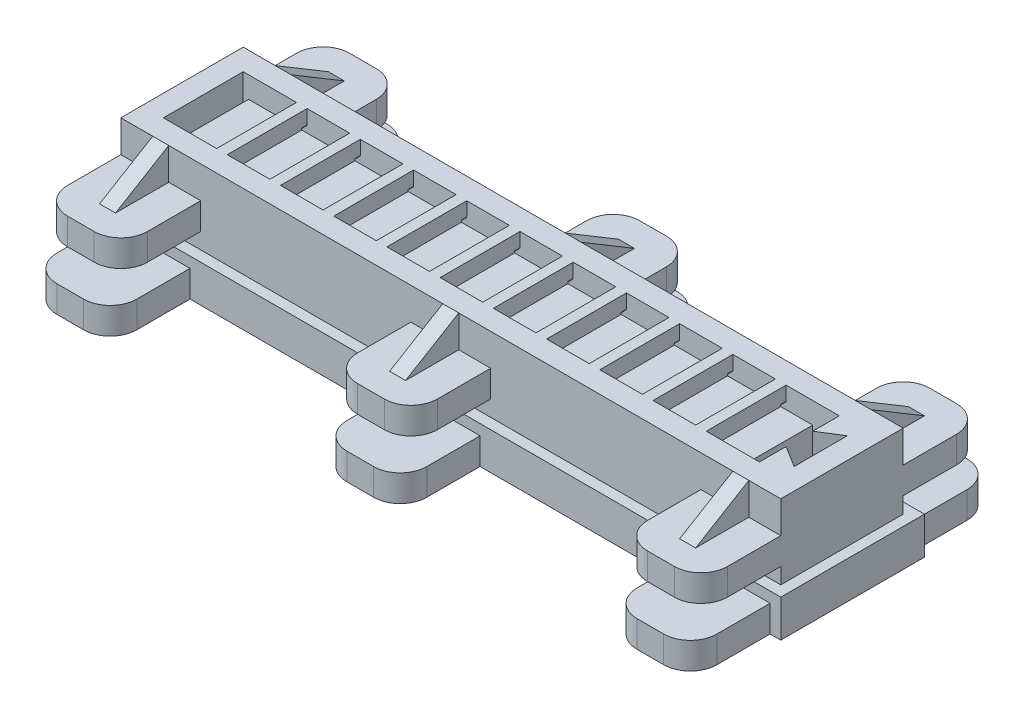
from build123d import *
from OCP.BRepFilletAPI import BRepFilletAPI_MakeChamfer

# Parameters (mm, degrees)
SKETCH1_W                       = 8
SKETCH1_H                       = 15
FIRST_CHAMBER_BLOCK_DEPTH       = 15
SKETCH2_W                       = 6
SKETCH2_H                       = 11
FIRST_CHAMBER_CAVITY_DEPTH      = 13
SKETCH3_W                       = 15
SKETCH3_H                       = 3
CHAMBER_SPACER_DEPTH            = 2
PATTERN_CHAMBERS_COUNT          = 11
PATTERN_CHAMBERS_PITCH          = 10
SKETCH4_W                       = 15
SKETCH4_H                       = 12
THICKEN_END_1_DEPTH             = 2
SKETCH5_W                       = 15
SKETCH5_H                       = 15
THICKEN_END_2_DEPTH             = 2
SKETCH6_W                       = 94
SKETCH6_H                       = 2
CENTRAL_AIR_CHANNEL_DEPTH       = 2
SKETCH7_W                       = 108
SKETCH7_H                       = 13
SKETCH7_W_2                     = 106
SKETCH7_H_2                     = 11
BONDING_RIDGE_DEPTH             = 2
SKETCH9_W                       = 2
SKETCH9_H                       = 2.5
BONDING_BUMPS_DEPTH             = 2
PATTERN_BONDING_BUMPS_COUNT     = 10
PATTERN_BONDING_BUMPS_PITCH     = 10
AUFSATZ_LINEAR_AUSTRAGEN3_REACH = 106.183
SCHNITT_LINEAR_AUSTRAGEN2_DEPTH = 113.026782512
LINEARES_MUSTER8_COUNT          = 10
LINEARES_MUSTER8_PITCH          = 10
BOSS_EXTRUDE1_START             = -15
BOSS_EXTRUDE1_DEPTH             = 15
ENCASING_BLOCK_DEPTH            = 21
SPLIT_START                     = -6
SPLIT_MOLD_OUTLINE_W            = 124
SPLIT_MOLD_OUTLINE_H            = 23
SPLIT_MOLD_DEPTH                = 6
SPLIT_MOLD_2_OUTLINE_W          = 6
SPLIT_MOLD_2_OUTLINE_H          = 11
SPLIT_MOLD_2_DEPTH              = 13
SPLIT_MOLD_3_OUTLINE_W          = 4
SPLIT_MOLD_3_OUTLINE_H          = 2
SPLIT_MOLD_3_DEPTH              = 2
SPLIT_START_2                   = 2
SPLIT_MOLD_4_DEPTH              = 11
SPLIT_START_3                   = -4
SPLIT_MOLD_5_DEPTH              = 23
SPLIT_MOLD_6_OUTLINE_W          = 108
SPLIT_MOLD_6_OUTLINE_H          = 2
SPLIT_MOLD_6_DEPTH              = 5
SPLIT_START_4                   = 14
SPLIT_MOLD_7_OUTLINE_W          = 108
SPLIT_MOLD_7_OUTLINE_H          = 2
SPLIT_MOLD_7_DEPTH              = 5
SPLIT_START_5                   = 6.5
SPLIT_MOLD_8_DEPTH              = 2
SPLIT_START_6                   = 5.5
SPLIT_MOLD_9_OUTLINE_W          = 2
SPLIT_MOLD_9_OUTLINE_H          = 2
SPLIT_MOLD_9_DEPTH              = 4
SPLIT_MOLD_10_OUTLINE_W         = 2
SPLIT_MOLD_10_OUTLINE_H         = 2
SPLIT_MOLD_10_DEPTH             = 1
SPLIT_START_7                   = 12
SPLIT_MOLD_11_OUTLINE_W         = 2
SPLIT_MOLD_11_OUTLINE_H         = 2
SPLIT_MOLD_11_DEPTH             = 1
SKETCH11_W                      = 15
SKETCH11_H                      = 5
GRIP_TAB_1_DEPTH                = 15
VERRUNDUNG1_R                   = 5
SKETCH13_W                      = 128
SKETCH13_H                      = 27
SKETCH13_W_2                    = 124
SKETCH13_H_2                    = 23
BASE_MOLD_LIP_DEPTH             = 7
SKETCH14_W                      = 15
SKETCH14_H                      = 5
BASE_GRIP_TABS_1_AND_2_DEPTH    = 15
SKETCH16_W                      = 15
SKETCH16_H                      = 5
BASE_GRIP_TABS_3_AND_4_DEPTH    = 15
FILLET_BASE_GRIP_TABS_R         = 5
SKIZZE1_W                       = 3
SKIZZE1_H                       = 6
AUFSATZ_LINEAR_AUSTRAGEN1_DEPTH = 10
FASE1_SIZE                      = 10
FASE1_SIZE_2                    = 6
FASE2_SIZE                      = 10
FASE2_SIZE_2                    = 6


# Read off the part's stored shape, not the designer's step: split mold
with BuildPart() as part:
    # Sketch1 → first chamber block (new body)
    with BuildSketch(Plane.XY):
        with Locations((4, 7.5)):
            Rectangle(SKETCH1_W, SKETCH1_H)
    extrude(amount=FIRST_CHAMBER_BLOCK_DEPTH)

    # Sketch2 → first chamber cavity (cut)
    with BuildSketch(Plane.XZ):
        with Locations((4, 7.5)):
            Rectangle(SKETCH2_W, SKETCH2_H)
    extrude(amount=-FIRST_CHAMBER_CAVITY_DEPTH, mode=Mode.SUBTRACT)

    # Sketch3 → chamber spacer (add)
    with BuildSketch(Plane(origin=(8, 0, 0), x_dir=(0, 0, -1), z_dir=(1, 0, 0))):
        with Locations((-7.5, 1.5)):
            Rectangle(SKETCH3_W, SKETCH3_H)
    extrude(amount=CHAMBER_SPACER_DEPTH)


with BuildPart() as pattern_chambers_1:
    # pattern chambers: pattern copy
    add(part.part.moved(Location(Vector(1, 0, 0) * (1 * PATTERN_CHAMBERS_PITCH))))


with BuildPart() as pattern_chambers_2:
    # pattern chambers: pattern copy
    add(part.part.moved(Location(Vector(1, 0, 0) * (2 * PATTERN_CHAMBERS_PITCH))))


with BuildPart() as pattern_chambers_3:
    # pattern chambers: pattern copy
    add(part.part.moved(Location(Vector(1, 0, 0) * (3 * PATTERN_CHAMBERS_PITCH))))


with BuildPart() as pattern_chambers_4:
    # pattern chambers: pattern copy
    add(part.part.moved(Location(Vector(1, 0, 0) * (4 * PATTERN_CHAMBERS_PITCH))))


with BuildPart() as pattern_chambers_5:
    # pattern chambers: pattern copy
    add(part.part.moved(Location(Vector(1, 0, 0) * (5 * PATTERN_CHAMBERS_PITCH))))


with BuildPart() as pattern_chambers_6:
    # pattern chambers: pattern copy
    add(part.part.moved(Location(Vector(1, 0, 0) * (6 * PATTERN_CHAMBERS_PITCH))))


with BuildPart() as pattern_chambers_7:
    # pattern chambers: pattern copy
    add(part.part.moved(Location(Vector(1, 0, 0) * (7 * PATTERN_CHAMBERS_PITCH))))


with BuildPart() as pattern_chambers_8:
    # pattern chambers: pattern copy
    add(part.part.moved(Location(Vector(1, 0, 0) * (8 * PATTERN_CHAMBERS_PITCH))))


with BuildPart() as pattern_chambers_9:
    # pattern chambers: pattern copy
    add(part.part.moved(Location(Vector(1, 0, 0) * (9 * PATTERN_CHAMBERS_PITCH))))


with BuildPart() as pattern_chambers_10:
    # pattern chambers: pattern copy
    add(part.part.moved(Location(Vector(1, 0, 0) * (10 * PATTERN_CHAMBERS_PITCH))))

    # combine into 1 solid body: union pattern chambers_9, pattern chambers_8, pattern chambers_7, pattern chambers_6, pattern chambers_5, pattern chambers_4, pattern chambers_3, pattern chambers_2, pattern chambers_1, part
    add(pattern_chambers_9.part)
    add(pattern_chambers_8.part)
    add(pattern_chambers_7.part)
    add(pattern_chambers_6.part)
    add(pattern_chambers_5.part)
    add(pattern_chambers_4.part)
    add(pattern_chambers_3.part)
    add(pattern_chambers_2.part)
    add(pattern_chambers_1.part)
    add(part.part)

    # Sketch4 → thicken end 1 (add)
    with BuildSketch(Plane(origin=(108, 0, 0), x_dir=(0, 0, -1), z_dir=(1, 0, 0))):
        with Locations((-7.5, 9)):
            Rectangle(SKETCH4_W, SKETCH4_H)
    extrude(amount=THICKEN_END_1_DEPTH)

    # Sketch5 → thicken end 2 (add)
    with BuildSketch(Plane.ZY):
        with Locations((7.5, 7.5)):
            Rectangle(SKETCH5_W, SKETCH5_H)
    extrude(amount=THICKEN_END_2_DEPTH)

    # Sketch6 → central air channel (cut)
    with BuildSketch(Plane.XZ):
        with Locations((54, 7.5)):
            Rectangle(SKETCH6_W, SKETCH6_H)
    extrude(amount=-CENTRAL_AIR_CHANNEL_DEPTH, mode=Mode.SUBTRACT)

    # Sketch7 → bonding ridge (add)
    with BuildSketch(Plane.XZ):
        with Locations((54, 7.5)):
            Rectangle(SKETCH7_W, SKETCH7_H)
        with Locations((54, 7.5)):
            Rectangle(SKETCH7_W_2, SKETCH7_H_2, mode=Mode.SUBTRACT)
    extrude(amount=BONDING_RIDGE_DEPTH)

    # Sketch9 → bonding bumps (add)
    with BuildSketch(Plane.XZ):
        with Locations((9, 10.75)):
            Rectangle(SKETCH9_W, SKETCH9_H)
        with Locations((9, 4.25)):
            Rectangle(SKETCH9_W, SKETCH9_H)
    bonding_bumps = extrude(amount=BONDING_BUMPS_DEPTH)

    # pattern bonding bumps: bonding bumps ×10
    with Locations(*[(i * PATTERN_BONDING_BUMPS_PITCH, 0, 0) for i in range(1, PATTERN_BONDING_BUMPS_COUNT)]):
        add(bonding_bumps)

    # Skizze3 → Aufsatz-Linear austragen3 (add, up to next)
    with BuildSketch(Plane(origin=(8, 0, 0), x_dir=(0, 0, -1), z_dir=(1, 0, 0)), mode=Mode.PRIVATE) as aufsatz_linear_austragen3_sk1:
        Polygon((-15, 3), (-13.5, 3), (-14, 12.5), (-15, 12.5), align=None)
    aufsatz_linear_austragen3_tool1 = extrude(aufsatz_linear_austragen3_sk1.sketch, amount=AUFSATZ_LINEAR_AUSTRAGEN3_REACH, mode=Mode.PRIVATE) - pattern_chambers_10.part
    # Skizze3 → Aufsatz-Linear austragen3 (add, up to next)
    with BuildSketch(Plane(origin=(8, 0, 0), x_dir=(0, 0, -1), z_dir=(1, 0, 0)), mode=Mode.PRIVATE) as aufsatz_linear_austragen3_sk2:
        Polygon((0, 12.5), (0, 3), (-1.5, 3), (-1, 12.5), align=None)
    aufsatz_linear_austragen3_tool2 = extrude(aufsatz_linear_austragen3_sk2.sketch, amount=AUFSATZ_LINEAR_AUSTRAGEN3_REACH, mode=Mode.PRIVATE) - pattern_chambers_10.part
    aufsatz_linear_austragen3_1 = aufsatz_linear_austragen3_tool1.solids().sort_by_distance((8, 7.433333, 14.366667))[0]
    add(aufsatz_linear_austragen3_1)
    aufsatz_linear_austragen3_2 = aufsatz_linear_austragen3_tool2.solids().sort_by_distance((8, 7.433333, 0.633333))[0]
    add(aufsatz_linear_austragen3_2)
    aufsatz_linear_austragen3 = aufsatz_linear_austragen3_1 + aufsatz_linear_austragen3_2  # Aufsatz-Linear austragen3 as one shape, for the pattern or mirror that repeats it

    # Skizze5 → Schnitt-Linear austragen2 (cut, through all)
    with BuildSketch(Plane(origin=(0, 0, 0), x_dir=(-1, 0, 0), z_dir=(0, 0, -1))):
        with BuildLine():
            Line((-10, 12.5), (-8, 12.5))
            Line((-8, 12.5), (-8, 12.45))
            ThreePointArc((-8, 12.45), (-8.131801948, 12.131801948), (-8.45, 12))
            Line((-8.45, 12), (-9.55, 12))
            ThreePointArc((-9.55, 12), (-9.868198052, 12.131801948), (-10, 12.45))
            Line((-10, 12.45), (-10, 12.5))
        make_face()
    schnitt_linear_austragen2 = extrude(amount=-SCHNITT_LINEAR_AUSTRAGEN2_DEPTH, mode=Mode.SUBTRACT)

    # Lineares Muster8: Aufsatz-Linear austragen3, Schnitt-Linear austragen2 ×10
    with Locations(*[(i * LINEARES_MUSTER8_PITCH, 0, 0) for i in range(1, LINEARES_MUSTER8_COUNT)]):
        add(aufsatz_linear_austragen3)
        add(schnitt_linear_austragen2, mode=Mode.SUBTRACT)

    # Sketch18 → Boss-Extrude1 (add)
    with BuildSketch(Plane(origin=(0, 15, 0), x_dir=(1, 0, 0), z_dir=(0, 1, 0)).offset(BOSS_EXTRUDE1_START)):
        Polygon((110, -5), (114, -2.5), (114, -12.5), (110, -10), align=None)
    extrude(amount=BOSS_EXTRUDE1_DEPTH)


with BuildPart() as body_2:
    # Sketch10 → encasing block (new body)
    with BuildSketch(Plane(origin=(0, 15, 0), x_dir=(1, 0, 0), z_dir=(0, 1, 0))):
        Polygon((-6, 4), (114, 4), (118, 4), (118, -19), (114, -19), (-6, -19), align=None)
    extrude(amount=-ENCASING_BLOCK_DEPTH)

    # subtract actuator: cut pattern chambers_10
    add(pattern_chambers_10.part, mode=Mode.SUBTRACT)

    # split mold outline → split mold (cut)
    with BuildSketch(Plane(origin=(0, 0, 0), x_dir=(1, 0, 0), z_dir=(0, 1, 0)).offset(SPLIT_START)):
        with Locations((56, -7.5)):
            Rectangle(SPLIT_MOLD_OUTLINE_W, SPLIT_MOLD_OUTLINE_H)
    extrude(amount=SPLIT_MOLD_DEPTH, mode=Mode.SUBTRACT)

    # split mold 2 outline → split mold 2 (cut)
    with BuildSketch(Plane(origin=(0, 0, 0), x_dir=(1, 0, 0), z_dir=(0, 1, 0))):
        with Locations((14, -7.5)):
            Rectangle(SPLIT_MOLD_2_OUTLINE_W, SPLIT_MOLD_2_OUTLINE_H)
        with Locations((4, -7.5)):
            Rectangle(SPLIT_MOLD_2_OUTLINE_W, SPLIT_MOLD_2_OUTLINE_H)
        with Locations((24, -7.5)):
            Rectangle(SPLIT_MOLD_2_OUTLINE_W, SPLIT_MOLD_2_OUTLINE_H)
        with Locations((34, -7.5)):
            Rectangle(SPLIT_MOLD_2_OUTLINE_W, SPLIT_MOLD_2_OUTLINE_H)
        with Locations((44, -7.5)):
            Rectangle(SPLIT_MOLD_2_OUTLINE_W, SPLIT_MOLD_2_OUTLINE_H)
        with Locations((54, -7.5)):
            Rectangle(SPLIT_MOLD_2_OUTLINE_W, SPLIT_MOLD_2_OUTLINE_H)
        with Locations((64, -7.5)):
            Rectangle(SPLIT_MOLD_2_OUTLINE_W, SPLIT_MOLD_2_OUTLINE_H)
        with Locations((74, -7.5)):
            Rectangle(SPLIT_MOLD_2_OUTLINE_W, SPLIT_MOLD_2_OUTLINE_H)
        with Locations((84, -7.5)):
            Rectangle(SPLIT_MOLD_2_OUTLINE_W, SPLIT_MOLD_2_OUTLINE_H)
        with Locations((94, -7.5)):
            Rectangle(SPLIT_MOLD_2_OUTLINE_W, SPLIT_MOLD_2_OUTLINE_H)
        with Locations((104, -7.5)):
            Rectangle(SPLIT_MOLD_2_OUTLINE_W, SPLIT_MOLD_2_OUTLINE_H)
    extrude(amount=SPLIT_MOLD_2_DEPTH, mode=Mode.SUBTRACT)

    # split mold 3 outline → split mold 3 (cut)
    with BuildSketch(Plane(origin=(0, 0, 0), x_dir=(1, 0, 0), z_dir=(0, 1, 0))):
        with Locations((9, -7.5)):
            Rectangle(SPLIT_MOLD_3_OUTLINE_W, SPLIT_MOLD_3_OUTLINE_H)
        with Locations((19, -7.5)):
            Rectangle(SPLIT_MOLD_3_OUTLINE_W, SPLIT_MOLD_3_OUTLINE_H)
        with Locations((29, -7.5)):
            Rectangle(SPLIT_MOLD_3_OUTLINE_W, SPLIT_MOLD_3_OUTLINE_H)
        with Locations((39, -7.5)):
            Rectangle(SPLIT_MOLD_3_OUTLINE_W, SPLIT_MOLD_3_OUTLINE_H)
        with Locations((49, -7.5)):
            Rectangle(SPLIT_MOLD_3_OUTLINE_W, SPLIT_MOLD_3_OUTLINE_H)
        with Locations((59, -7.5)):
            Rectangle(SPLIT_MOLD_3_OUTLINE_W, SPLIT_MOLD_3_OUTLINE_H)
        with Locations((69, -7.5)):
            Rectangle(SPLIT_MOLD_3_OUTLINE_W, SPLIT_MOLD_3_OUTLINE_H)
        with Locations((79, -7.5)):
            Rectangle(SPLIT_MOLD_3_OUTLINE_W, SPLIT_MOLD_3_OUTLINE_H)
        with Locations((89, -7.5)):
            Rectangle(SPLIT_MOLD_3_OUTLINE_W, SPLIT_MOLD_3_OUTLINE_H)
        with Locations((99, -7.5)):
            Rectangle(SPLIT_MOLD_3_OUTLINE_W, SPLIT_MOLD_3_OUTLINE_H)
    extrude(amount=SPLIT_MOLD_3_DEPTH, mode=Mode.SUBTRACT)

    # Sketch11 → grip tab 1 (add)
    with BuildSketch(Plane.XY.offset(19)):
        with Locations((1.5, 6.5)):
            Rectangle(SKETCH11_W, SKETCH11_H)
        with Locations((56, 6.5)):
            Rectangle(SKETCH11_W, SKETCH11_H)
        with Locations((110.5, 6.5)):
            Rectangle(SKETCH11_W, SKETCH11_H)
    grip_tab_1 = extrude(amount=GRIP_TAB_1_DEPTH)

    # Spiegeln1: grip tab 1 across plane
    add(grip_tab_1.mirror(Plane(origin=(0, 0, 7.5), x_dir=(1, 0, 0), z_dir=(0, 0, -1))))

    # Verrundung1
    verrundung1_edges = [body_2.edges().sort_by_distance(p)[0] for p in [
        (-6, 6.5, -19),
        (9, 6.5, -19),
        (48.5, 6.5, -19),
        (63.5, 6.5, -19),
        (103, 6.5, -19),
        (118, 6.5, -19),
        (118, 6.5, 34),
        (103, 6.5, 34),
        (63.5, 6.5, 34),
        (48.5, 6.5, 34),
        (9, 6.5, 34),
        (-6, 6.5, 34),
    ]]
    fillet(verrundung1_edges, radius=VERRUNDUNG1_R)

    # Skizze1 → Aufsatz-Linear austragen1 (add)
    with BuildSketch(Plane.XY.offset(19)):
        with Locations((1.5, 12)):
            Rectangle(SKIZZE1_W, SKIZZE1_H)
        with Locations((56, 12)):
            Rectangle(SKIZZE1_W, SKIZZE1_H)
        with Locations((110.5, 12)):
            Rectangle(SKIZZE1_W, SKIZZE1_H)
    aufsatz_linear_austragen1 = extrude(amount=AUFSATZ_LINEAR_AUSTRAGEN1_DEPTH)

    # Spiegeln2: Aufsatz-Linear austragen1 across plane
    add(aufsatz_linear_austragen1.mirror(Plane(origin=(0, 0, 7.5), x_dir=(1, 0, 0), z_dir=(0, 0, -1))))

    # Fase1
    fase1_edges_1 = [body_2.edges().sort_by_distance(p)[0] for p in [
        (1.5, 15, 29),
    ]]
    fase1_side_1 = [body_2.faces().sort_by_distance(p)[0] for p in [
        (1.5, 15, 28.88),
    ]]
    fase1_edges_2 = [body_2.edges().sort_by_distance(p)[0] for p in [
        (110.5, 15, 29),
    ]]
    fase1_side_2 = [body_2.faces().sort_by_distance(p)[0] for p in [
        (110.5, 15, 28.88),
    ]]
    fase1_edges_3 = [body_2.edges().sort_by_distance(p)[0] for p in [
        (56, 15, 29),
    ]]
    fase1_side_3 = [body_2.faces().sort_by_distance(p)[0] for p in [
        (56, 15, 28.88),
    ]]
    fase1 = BRepFilletAPI_MakeChamfer(body_2.part.solid().wrapped)
    for e in fase1_edges_1:
        fase1.Add(FASE1_SIZE - 0.0001, FASE1_SIZE_2 - 0.0001, e.wrapped, fase1_side_1[0].wrapped)
    for e in fase1_edges_2:
        fase1.Add(FASE1_SIZE - 0.0001, FASE1_SIZE_2 - 0.0001, e.wrapped, fase1_side_2[0].wrapped)
    for e in fase1_edges_3:
        fase1.Add(FASE1_SIZE - 0.0001, FASE1_SIZE_2 - 0.0001, e.wrapped, fase1_side_3[0].wrapped)
    add(Compound.cast(fase1.Shape()), mode=Mode.REPLACE)  # a hair under: the kernel refuses the full size

    # Fase2
    fase2_edges_1 = [body_2.edges().sort_by_distance(p)[0] for p in [
        (110.5, 15, -14),
    ]]
    fase2_side_1 = [body_2.faces().sort_by_distance(p)[0] for p in [
        (110.5, 15, -13.88),
    ]]
    fase2_edges_2 = [body_2.edges().sort_by_distance(p)[0] for p in [
        (56, 15, -14),
    ]]
    fase2_side_2 = [body_2.faces().sort_by_distance(p)[0] for p in [
        (56, 15, -13.88),
    ]]
    fase2_edges_3 = [body_2.edges().sort_by_distance(p)[0] for p in [
        (1.5, 15, -14),
    ]]
    fase2_side_3 = [body_2.faces().sort_by_distance(p)[0] for p in [
        (1.5, 15, -13.88),
    ]]
    fase2 = BRepFilletAPI_MakeChamfer(body_2.part.solid().wrapped)
    for e in fase2_edges_1:
        fase2.Add(FASE2_SIZE - 0.0001, FASE2_SIZE_2 - 0.0001, e.wrapped, fase2_side_1[0].wrapped)
    for e in fase2_edges_2:
        fase2.Add(FASE2_SIZE - 0.0001, FASE2_SIZE_2 - 0.0001, e.wrapped, fase2_side_2[0].wrapped)
    for e in fase2_edges_3:
        fase2.Add(FASE2_SIZE - 0.0001, FASE2_SIZE_2 - 0.0001, e.wrapped, fase2_side_3[0].wrapped)
    add(Compound.cast(fase2.Shape()), mode=Mode.REPLACE)  # a hair under: the kernel refuses the full size


with BuildPart() as body_2_2:
    # split mold 4 outline → split mold 4 (new body)
    with BuildSketch(Plane.XY.offset(SPLIT_START_2)):
        Polygon((7, 0), (7, 13), (1, 13), (1, -2), (0, -2), (0, 0), (-6, 0), (-6, -6), (118, -6), (118, 0), (108, 0), (108, -2), (107, -2), (107, 13), (101, 13), (101, 0), (100, 0), (100, -2), (98, -2), (98, 0), (97, 0), (97, 13), (91, 13), (91, 0), (90, 0), (90, -2), (88, -2), (88, 0), (87, 0), (87, 13), (81, 13), (81, 0), (80, 0), (80, -2), (78, -2), (78, 0), (77, 0), (77, 13), (71, 13), (71, 0), (70, 0), (70, -2), (68, -2), (68, 0), (67, 0), (67, 13), (61, 13), (61, 0), (60, 0), (60, -2), (58, -2), (58, 0), (57, 0), (57, 13), (51, 13), (51, 0), (50, 0), (50, -2), (48, -2), (48, 0), (47, 0), (47, 13), (41, 13), (41, 0), (40, 0), (40, -2), (38, -2), (38, 0), (37, 0), (37, 13), (31, 13), (31, 0), (30, 0), (30, -2), (28, -2), (28, 0), (27, 0), (27, 13), (21, 13), (21, 0), (20, 0), (20, -2), (18, -2), (18, 0), (17, 0), (17, 13), (11, 13), (11, 0), (10, 0), (10, -2), (8, -2), (8, 0), align=None)
    extrude(amount=SPLIT_MOLD_4_DEPTH)

    # split mold 5 outline → split mold 5 (add)
    with BuildSketch(Plane.XY.offset(SPLIT_START_3)):
        Polygon((108, -2), (0, -2), (0, 0), (-6, 0), (-6, -6), (118, -6), (118, 0), (108, 0), align=None)
    extrude(amount=SPLIT_MOLD_5_DEPTH)

    # split mold 6 outline → split mold 6 (add)
    with BuildSketch(Plane.XY.offset(SPLIT_START_3)):
        with Locations((54, -1)):
            Rectangle(SPLIT_MOLD_6_OUTLINE_W, SPLIT_MOLD_6_OUTLINE_H)
    extrude(amount=SPLIT_MOLD_6_DEPTH)

    # split mold 7 outline → split mold 7 (add)
    with BuildSketch(Plane.XY.offset(SPLIT_START_4)):
        with Locations((54, -1)):
            Rectangle(SPLIT_MOLD_7_OUTLINE_W, SPLIT_MOLD_7_OUTLINE_H)
    extrude(amount=SPLIT_MOLD_7_DEPTH)

    # split mold 8 outline → split mold 8 (add)
    with BuildSketch(Plane.XY.offset(SPLIT_START_5)):
        Polygon((11, 2), (7, 2), (7, 0), (8, 0), (8, -2), (10, -2), (10, 0), (11, 0), align=None)
        Polygon((17, 2), (17, 0), (18, 0), (18, -2), (20, -2), (20, 0), (21, 0), (21, 2), align=None)
        Polygon((27, 2), (27, 0), (28, 0), (28, -2), (30, -2), (30, 0), (31, 0), (31, 2), align=None)
        Polygon((38, 0), (38, -2), (40, -2), (40, 0), (41, 0), (41, 2), (37, 2), (37, 0), align=None)
        Polygon((100, 0), (101, 0), (101, 2), (97, 2), (97, 0), (98, 0), (98, -2), (100, -2), align=None)
        Polygon((48, 0), (48, -2), (50, -2), (50, 0), (51, 0), (51, 2), (47, 2), (47, 0), align=None)
        Polygon((58, 0), (58, -2), (60, -2), (60, 0), (61, 0), (61, 2), (57, 2), (57, 0), align=None)
        Polygon((88, -2), (90, -2), (90, 0), (91, 0), (91, 2), (87, 2), (87, 0), (88, 0), align=None)
        Polygon((68, 0), (68, -2), (70, -2), (70, 0), (71, 0), (71, 2), (67, 2), (67, 0), align=None)
        Polygon((78, -2), (80, -2), (80, 0), (81, 0), (81, 2), (77, 2), (77, 0), (78, 0), align=None)
    extrude(amount=SPLIT_MOLD_8_DEPTH)

    # split mold 9 outline → split mold 9 (add)
    with BuildSketch(Plane.XY.offset(SPLIT_START_6)):
        with Locations((9, -1)):
            Rectangle(SPLIT_MOLD_9_OUTLINE_W, SPLIT_MOLD_9_OUTLINE_H)
        with Locations((19, -1)):
            Rectangle(SPLIT_MOLD_9_OUTLINE_W, SPLIT_MOLD_9_OUTLINE_H)
        with Locations((29, -1)):
            Rectangle(SPLIT_MOLD_9_OUTLINE_W, SPLIT_MOLD_9_OUTLINE_H)
        with Locations((39, -1)):
            Rectangle(SPLIT_MOLD_9_OUTLINE_W, SPLIT_MOLD_9_OUTLINE_H)
        with Locations((49, -1)):
            Rectangle(SPLIT_MOLD_9_OUTLINE_W, SPLIT_MOLD_9_OUTLINE_H)
        with Locations((99, -1)):
            Rectangle(SPLIT_MOLD_9_OUTLINE_W, SPLIT_MOLD_9_OUTLINE_H)
        with Locations((59, -1)):
            Rectangle(SPLIT_MOLD_9_OUTLINE_W, SPLIT_MOLD_9_OUTLINE_H)
        with Locations((89, -1)):
            Rectangle(SPLIT_MOLD_9_OUTLINE_W, SPLIT_MOLD_9_OUTLINE_H)
        with Locations((69, -1)):
            Rectangle(SPLIT_MOLD_9_OUTLINE_W, SPLIT_MOLD_9_OUTLINE_H)
        with Locations((79, -1)):
            Rectangle(SPLIT_MOLD_9_OUTLINE_W, SPLIT_MOLD_9_OUTLINE_H)
    extrude(amount=SPLIT_MOLD_9_DEPTH)

    # split mold 10 outline → split mold 10 (add)
    with BuildSketch(Plane.XY.offset(SPLIT_START_2)):
        with Locations((9, -1)):
            Rectangle(SPLIT_MOLD_10_OUTLINE_W, SPLIT_MOLD_10_OUTLINE_H)
        with Locations((19, -1)):
            Rectangle(SPLIT_MOLD_10_OUTLINE_W, SPLIT_MOLD_10_OUTLINE_H)
        with Locations((29, -1)):
            Rectangle(SPLIT_MOLD_10_OUTLINE_W, SPLIT_MOLD_10_OUTLINE_H)
        with Locations((39, -1)):
            Rectangle(SPLIT_MOLD_10_OUTLINE_W, SPLIT_MOLD_10_OUTLINE_H)
        with Locations((49, -1)):
            Rectangle(SPLIT_MOLD_10_OUTLINE_W, SPLIT_MOLD_10_OUTLINE_H)
        with Locations((99, -1)):
            Rectangle(SPLIT_MOLD_10_OUTLINE_W, SPLIT_MOLD_10_OUTLINE_H)
        with Locations((59, -1)):
            Rectangle(SPLIT_MOLD_10_OUTLINE_W, SPLIT_MOLD_10_OUTLINE_H)
        with Locations((89, -1)):
            Rectangle(SPLIT_MOLD_10_OUTLINE_W, SPLIT_MOLD_10_OUTLINE_H)
        with Locations((69, -1)):
            Rectangle(SPLIT_MOLD_10_OUTLINE_W, SPLIT_MOLD_10_OUTLINE_H)
        with Locations((79, -1)):
            Rectangle(SPLIT_MOLD_10_OUTLINE_W, SPLIT_MOLD_10_OUTLINE_H)
    extrude(amount=SPLIT_MOLD_10_DEPTH)

    # split mold 11 outline → split mold 11 (add)
    with BuildSketch(Plane.XY.offset(SPLIT_START_7)):
        with Locations((9, -1)):
            Rectangle(SPLIT_MOLD_11_OUTLINE_W, SPLIT_MOLD_11_OUTLINE_H)
        with Locations((19, -1)):
            Rectangle(SPLIT_MOLD_11_OUTLINE_W, SPLIT_MOLD_11_OUTLINE_H)
        with Locations((29, -1)):
            Rectangle(SPLIT_MOLD_11_OUTLINE_W, SPLIT_MOLD_11_OUTLINE_H)
        with Locations((39, -1)):
            Rectangle(SPLIT_MOLD_11_OUTLINE_W, SPLIT_MOLD_11_OUTLINE_H)
        with Locations((49, -1)):
            Rectangle(SPLIT_MOLD_11_OUTLINE_W, SPLIT_MOLD_11_OUTLINE_H)
        with Locations((99, -1)):
            Rectangle(SPLIT_MOLD_11_OUTLINE_W, SPLIT_MOLD_11_OUTLINE_H)
        with Locations((59, -1)):
            Rectangle(SPLIT_MOLD_11_OUTLINE_W, SPLIT_MOLD_11_OUTLINE_H)
        with Locations((89, -1)):
            Rectangle(SPLIT_MOLD_11_OUTLINE_W, SPLIT_MOLD_11_OUTLINE_H)
        with Locations((69, -1)):
            Rectangle(SPLIT_MOLD_11_OUTLINE_W, SPLIT_MOLD_11_OUTLINE_H)
        with Locations((79, -1)):
            Rectangle(SPLIT_MOLD_11_OUTLINE_W, SPLIT_MOLD_11_OUTLINE_H)
    extrude(amount=SPLIT_MOLD_11_DEPTH)

    # Sketch13 → base mold lip (add)
    with BuildSketch(Plane.XZ.offset(6)):
        with Locations((56, 7.5)):
            Rectangle(SKETCH13_W, SKETCH13_H)
        with Locations((56, 7.5)):
            Rectangle(SKETCH13_W_2, SKETCH13_H_2, mode=Mode.SUBTRACT)
    extrude(amount=-BASE_MOLD_LIP_DEPTH)

    # Sketch14 → base grip tabs 1 and 2 (add)
    with BuildSketch(Plane.XY.offset(21)):
        with Locations((1.5, -3.5)):
            Rectangle(SKETCH14_W, SKETCH14_H)
        with Locations((110.5, -3.5)):
            Rectangle(SKETCH14_W, SKETCH14_H)
        with Locations((56, -3.5)):
            Rectangle(SKETCH14_W, SKETCH14_H)
    extrude(amount=BASE_GRIP_TABS_1_AND_2_DEPTH)

    # Sketch16 → base grip tabs 3 and 4 (add)
    with BuildSketch(Plane(origin=(0, 0, -6), x_dir=(-1, 0, 0), z_dir=(0, 0, -1))):
        with Locations((-110.5, -3.5)):
            Rectangle(SKETCH16_W, SKETCH16_H)
        with Locations((-1.5, -3.5)):
            Rectangle(SKETCH16_W, SKETCH16_H)
        with Locations((-56, -3.5)):
            Rectangle(SKETCH16_W, SKETCH16_H)
    extrude(amount=BASE_GRIP_TABS_3_AND_4_DEPTH)

    # fillet base grip tabs
    fillet_base_grip_tabs_edges = [body_2_2.edges().sort_by_distance(p)[0] for p in [
        (118, -3.5, -21),
        (103, -3.5, -21),
        (9, -3.5, -21),
        (-6, -3.5, -21),
        (118, -3.5, 36),
        (103, -3.5, 36),
        (9, -3.5, 36),
        (-6, -3.5, 36),
        (48.5, -3.5, 36),
        (63.5, -3.5, 36),
        (48.5, -3.5, -21),
        (63.5, -3.5, -21),
    ]]
    fillet(fillet_base_grip_tabs_edges, radius=FILLET_BASE_GRIP_TABS_R)


solid = Compound([body_2.part, body_2_2.part])
